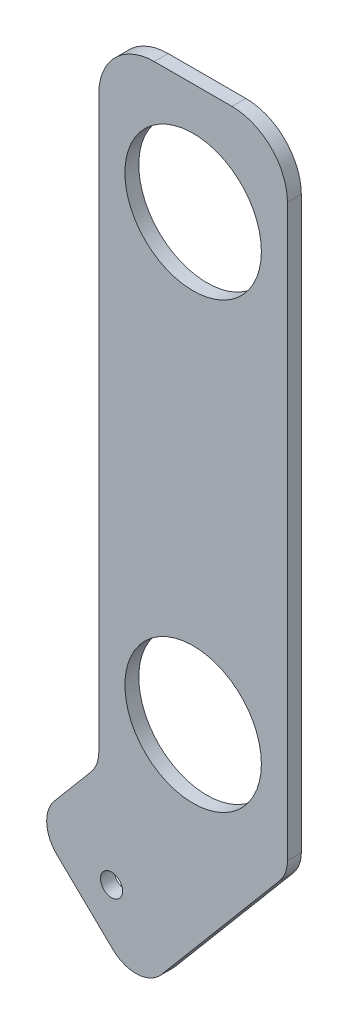
from build123d import *

# Parameters (mm, degrees)
SKETCH1_R           = 15.621
SKETCH1_R_2         = 2.54
BOSS_EXTRUDE1_DEPTH = 3.175


with BuildPart() as part:
    # Sketch1 → Boss-Extrude1 (new body)
    with BuildSketch(Plane.XY):
        with BuildLine():
            Line((-8.89, 25.4), (8.89, 25.4))
            ThreePointArc((8.89, 25.4), (17.870256121, 21.680256121), (21.59, 12.7))
            Line((21.59, 12.7), (21.59, -117.775079775))
            ThreePointArc((21.59, -117.775079775), (21.127743647, -120.388718212), (19.797058824, -122.685251408))
            Line((19.797058824, -122.685251408), (-7.265245808, -154.800959935))
            ThreePointArc((-7.265245808, -154.800959935), (-12.702595742, -157.500816356), (-18.387297428, -155.370519251))
            Line((-18.387297428, -155.370519251), (-31.202992042, -142.986880112))
            ThreePointArc((-31.202992042, -142.986880112), (-33.518027299, -137.896858051), (-31.735058069, -132.596977529))
            Line((-31.735058069, -132.596977529), (-23.382941176, -122.685251408))
            ThreePointArc((-23.382941176, -122.685251408), (-22.052256353, -120.388718212), (-21.59, -117.775079775))
            Line((-21.59, -117.775079775), (-21.59, 12.7))
            ThreePointArc((-21.59, 12.7), (-17.870256121, 21.680256121), (-8.89, 25.4))
        make_face()
        Circle(SKETCH1_R, mode=Mode.SUBTRACT)
        with Locations((0, -101.6)):
            Circle(SKETCH1_R, mode=Mode.SUBTRACT)
        with Locations((-18.679891904, -142.72553973)):
            Circle(SKETCH1_R_2, mode=Mode.SUBTRACT)
    extrude(amount=BOSS_EXTRUDE1_DEPTH)


solid = part.part
